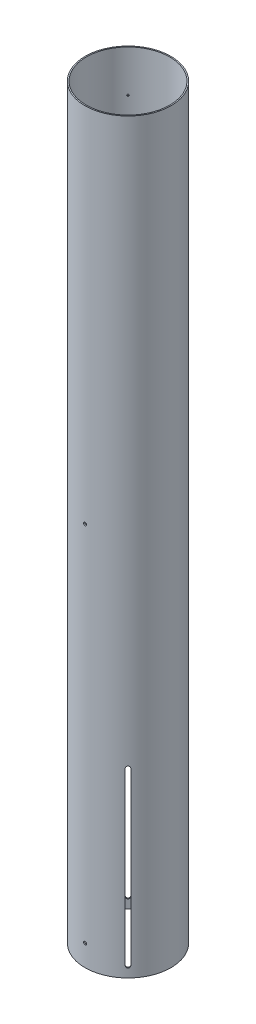
from build123d import *

# Parameters (mm, degrees)
SKETCH1_R           = 51.054
SKETCH1_R_2         = 49.657
BOSS_EXTRUDE1_DEPTH = 887.984
CUT_EXTRUDE1_DEPTH  = 152.4
CIRPATTERN1_COUNT   = 4
SKETCH3_R           = 1.7653
CUT_EXTRUDE2_DEPTH  = 11.684
SKETCH4_R           = 1.0922
CUT_EXTRUDE3_DEPTH  = 25.4
CIRPATTERN2_COUNT   = 2


with BuildPart() as part:
    # Sketch1 → Boss-Extrude1 (new body)
    with BuildSketch(Plane(origin=(0, 0, 0), x_dir=(1, 0, 0), z_dir=(0, 1, 0))):
        Circle(SKETCH1_R)
        Circle(SKETCH1_R_2, mode=Mode.SUBTRACT)
    extrude(amount=BOSS_EXTRUDE1_DEPTH)

    # Sketch2 → Cut-Extrude1 (cut)
    with BuildSketch(Plane(origin=(14.492117094, 1243.355570529, -192.628510082), x_dir=(0, 1, 0), z_dir=(0.7071067811865634, 0, -0.7071067811865316))):
        with BuildLine():
            Line((-1230.655570529, 128.342701458), (-1027.455570529, 128.342701458))
            ThreePointArc((-1027.455570529, 128.342701458), (-1025.074320529, 125.961451458), (-1027.455570529, 123.580201458))
            Line((-1027.455570529, 123.580201458), (-1230.655570529, 123.580201458))
            ThreePointArc((-1230.655570529, 123.580201458), (-1233.036820529, 125.961451458), (-1230.655570529, 128.342701458))
        make_face()
    cut_extrude1 = extrude(amount=-CUT_EXTRUDE1_DEPTH, mode=Mode.SUBTRACT)

    # CirPattern1: Cut-Extrude1 ×4 about axis
    cirpattern1_axis = Axis((0, 887.984, 0), (0, -1, 0))
    for i in range(1, CIRPATTERN1_COUNT):
        add(cut_extrude1.rotate(cirpattern1_axis, i * 360 / CIRPATTERN1_COUNT), mode=Mode.SUBTRACT)

    # Sketch3 → Cut-Extrude2 (cut)
    with BuildSketch(Plane(origin=(271.091614788, 1243.355570529, 52.3875), x_dir=(-1, 0, 0), z_dir=(0, 0, 1))):
        with Locations((271.091614788, 1217.955570529)):
            Circle(SKETCH3_R)
        with Locations((271.091614788, 786.155570529)):
            Circle(SKETCH3_R)
    extrude(amount=-CUT_EXTRUDE2_DEPTH, mode=Mode.SUBTRACT)

    # Sketch4 → Cut-Extrude3 (cut)
    with BuildSketch(Plane(origin=(120.58027232, 708.404628356, -48.738223352), x_dir=(-0.7071067811865634, 2.660214291711019e-15, 0.7071067811865317), z_dir=(0.7071067811865317, -1.2152886494782433e-14, 0.7071067811865634))):
        with Locations((119.72625647, -129.795371644)):
            Circle(SKETCH4_R)
    cut_extrude3 = extrude(amount=-CUT_EXTRUDE3_DEPTH, mode=Mode.SUBTRACT)

    # CirPattern2: Cut-Extrude3 ×2 about axis
    cirpattern2_axis = Axis((0, 887.984, 0), (0, -1, 0))
    for i in range(1, CIRPATTERN2_COUNT):
        add(cut_extrude3.rotate(cirpattern2_axis, i * 360 / CIRPATTERN2_COUNT), mode=Mode.SUBTRACT)


solid = part.part
